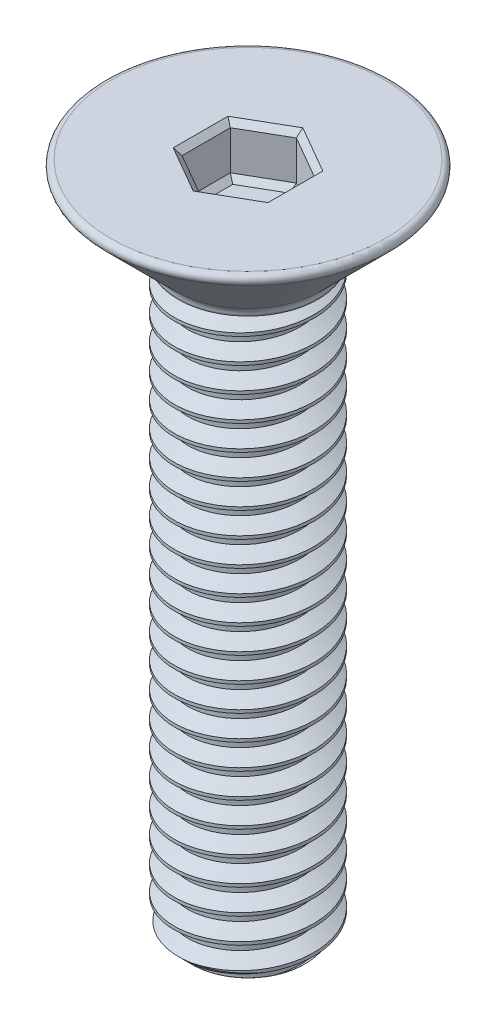
from build123d import *

# Parameters (mm, degrees)
SKETCH1_R           = 1.25
BOSS_EXTRUDE1_DEPTH = 10.45
THREAD1_PITCH       = 0.45
SKETCH5_R           = 1.25
BOSS_EXTRUDE2_DEPTH = 0.1
SKETCH6_R           = 1.25
BOSS_EXTRUDE3_DEPTH = 1.45
BOSS_EXTRUDE3_DRAFT = -45
FILLET1_R           = 0.2
FILLET2_R           = 0.1
CUT_EXTRUDE1_DEPTH  = 0.8
CHAMFER1_SIZE       = 0.1
CUT_EXTRUDE2_DEPTH  = 0.1
CUT_EXTRUDE2_DRAFT  = -45


with BuildPart() as part:
    # Sketch1 → Boss-Extrude1 (new body)
    with BuildSketch(Plane(origin=(0, 0, 0), x_dir=(1, 0, 0), z_dir=(0, 1, 0))):
        with Locations(Location((0, 0, 0), (0, 0, 270))):
            Circle(SKETCH1_R)
    extrude(amount=BOSS_EXTRUDE1_DEPTH)

    # Thread1: the profile of Thread Profile1 profile screwed along a right-hand helix of 25.444444 turns, 6 arcs to a turn; built about Z, then put on its axis
    thread1_z = Axis((0, 0, 0), (0, 0, 1))
    thread1_corners = [(1.2503, 0, -0.000173205), (1.2503, 0, 0.393923204), (1.006430356, 0, 0.253124999), (1.006430356, 0, 0.140624999)]
    with BuildLine(mode=Mode.PRIVATE) as thread1_profile:
        Line(thread1_corners[0], thread1_corners[1])
        Line(thread1_corners[1], thread1_corners[2])
        Line(thread1_corners[2], thread1_corners[3])
        Line(thread1_corners[3], thread1_corners[0])
    thread1_cap = Face(thread1_profile.wire())
    thread1_turn_angles = [0, 30, 60, 90, 120, 150, 180, 210, 240, 270, 300, 330, 360]
    thread1_turn_weights = [1, 0.8660254037844387, 1, 0.8660254037844387, 1, 0.8660254037844387, 1, 0.8660254037844387, 1, 0.8660254037844387, 1, 0.8660254037844387, 1]
    thread1_turn_rails = [Edge.make_bspline([Vector(p[0], p[1], 0).rotate(thread1_z, thread1_turn_angles[k]) / thread1_turn_weights[k] + Vector(0, 0, p[2] + THREAD1_PITCH * thread1_turn_angles[k] / 360) for k in range(13)], [0, 0, 0, 1, 1, 2, 2, 3, 3, 4, 4, 5, 5, 6, 6, 6], 2, thread1_turn_weights) for p in thread1_corners]
    thread1_turn_sides = [Face.make_surface_from_curves(thread1_turn_rails[p[0]], thread1_turn_rails[p[1]]) for p in [(0, 1), (1, 2), (2, 3), (3, 0)]]
    thread1_last_angles = [9000, 9030, 9060, 9090, 9120, 9140, 9160]
    thread1_last_weights = [1, 0.8660254037844387, 1, 0.8660254037844387, 1, 0.9396926207859139, 1]
    thread1_last_rails = [Edge.make_bspline([Vector(p[0], p[1], 0).rotate(thread1_z, thread1_last_angles[k]) / thread1_last_weights[k] + Vector(0, 0, p[2] + THREAD1_PITCH * thread1_last_angles[k] / 360) for k in range(7)], [0, 0, 0, 1, 1, 2, 2, 3, 3, 3], 2, thread1_last_weights) for p in thread1_corners]
    thread1_last_sides = [Face.make_surface_from_curves(thread1_last_rails[p[0]], thread1_last_rails[p[1]]) for p in [(0, 1), (1, 2), (2, 3), (3, 0)]]
    thread1 = Plane(origin=(0, -1, 0), x_dir=(1, 0, 0), z_dir=(0, 1, 0)) * Solid(Shell([*[p.moved(Location((0, 0, THREAD1_PITCH * i))) for i in range(25) for p in thread1_turn_sides], *thread1_last_sides, thread1_cap, thread1_cap.rotate(thread1_z, 9160).moved(Location((0, 0, THREAD1_PITCH * 9160 / 360)))]))
    add(thread1, mode=Mode.SUBTRACT)

    # Sketch5 → Boss-Extrude2 (add)
    with BuildSketch(Plane(origin=(0, 10.45, 0), x_dir=(1, 0, 0), z_dir=(0, 1, 0))):
        with Locations(Location((0, 0, 0), (0, 0, 80.405931773))):
            Circle(SKETCH5_R)
    extrude(amount=BOSS_EXTRUDE2_DEPTH)


with BuildPart() as boss_extrude3_tool:
    # Sketch6 → Boss-Extrude3 (with draft: the straight prism first)
    with BuildSketch(Plane(origin=(0, 10.55, 0), x_dir=(1, 0, 0), z_dir=(0, 1, 0))):
        with Locations(Location((0, 0, 0), (0, 0, 80.405931773))):
            Circle(SKETCH6_R)
    extrude(amount=BOSS_EXTRUDE3_DEPTH)
    # Boss-Extrude3: the draft: its side faces are tilted about the plane it starts from
    boss_extrude3_sides = [boss_extrude3_tool.faces().sort_by_distance(p)[0] for p in [
        (-0.208333333, 11.275, 1.232516621),
    ]]
    draft(boss_extrude3_sides, Plane(origin=(0, 10.55, 0), x_dir=(1, 0, 0), z_dir=(0, 1, 0)), BOSS_EXTRUDE3_DRAFT)


with BuildPart() as part_1:
    add(part.part)

    # Boss-Extrude3: add boss_extrude3_tool
    add(boss_extrude3_tool.part)

    # Fillet1
    fillet1_edges = [part_1.edges().sort_by_distance(p)[0] for p in [
        (-0.208333333, 10.55, 1.232516621),
    ]]
    fillet(fillet1_edges, radius=FILLET1_R)

    # Fillet2
    fillet2_edges = [part_1.edges().sort_by_distance(p)[0] for p in [
        (-0.45, 12, 2.662235902),
    ]]
    fillet(fillet2_edges, radius=FILLET2_R)

    # Sketch7 → Cut-Revolve1 (revolve, cut)
    with BuildSketch(Plane.XY, mode=Mode.PRIVATE) as cut_revolve1_sk:
        Polygon((1.26, 0), (1.26, 0.26), (1, 0), align=None)
    revolve(cut_revolve1_sk.sketch.rotate(Axis((0, 0, 0), (0, 1, 0)), 159.594068227), axis=Axis((0, 0, 0), (0, 1, 0)), mode=Mode.SUBTRACT)

    # Sketch8 → Cut-Extrude1 (cut)
    with BuildSketch(Plane(origin=(0, 12, 0), x_dir=(1, 0, 0), z_dir=(0, 1, 0))):
        Polygon((0, 0.866025404), (-0.75, 0.433012702), (-0.75, -0.433012702), (0, -0.866025404), (0.75, -0.433012702), (0.75, 0.433012702), align=None)
    extrude(amount=-CUT_EXTRUDE1_DEPTH, mode=Mode.SUBTRACT)

    # Chamfer1
    chamfer1_edges = [part_1.edges().sort_by_distance(p)[0] for p in [
        (0.375, 12, -0.649519053),
        (-0.375, 12, -0.649519053),
        (-0.75, 12, 0),
        (-0.375, 12, 0.649519053),
        (0.375, 12, 0.649519053),
        (0.75, 12, 0),
    ]]
    chamfer(chamfer1_edges, length=CHAMFER1_SIZE)


with BuildPart() as cut_extrude2_tool:
    # Sketch9 → Cut-Extrude2 (with draft: the straight prism first)
    with BuildSketch(Plane(origin=(0, 11.2, 0), x_dir=(1, 0, 0), z_dir=(0, 1, 0))):
        Polygon((0, 0.866025404), (-0.75, 0.433012702), (-0.75, -0.433012702), (0, -0.866025404), (0.75, -0.433012702), (0.75, 0.433012702), align=None)
    extrude(amount=-CUT_EXTRUDE2_DEPTH)
    # Cut-Extrude2: the draft: its side faces are tilted about the plane it starts from
    cut_extrude2_sides = [cut_extrude2_tool.faces().sort_by_distance(p)[0] for p in [
        (-0.375, 11.15, -0.649519053),
        (-0.75, 11.15, 0),
        (-0.375, 11.15, 0.649519053),
        (0.375, 11.15, 0.649519053),
        (0.75, 11.15, 0),
        (0.375, 11.15, -0.649519053),
    ]]
    draft(cut_extrude2_sides, Plane(origin=(0, 11.2, 0), x_dir=(1, 0, 0), z_dir=(0, 1, 0)), CUT_EXTRUDE2_DRAFT)


with BuildPart() as part_2:
    add(part_1.part)

    # Cut-Extrude2: cut by cut_extrude2_tool
    add(cut_extrude2_tool.part, mode=Mode.SUBTRACT)


solid = part_2.part
